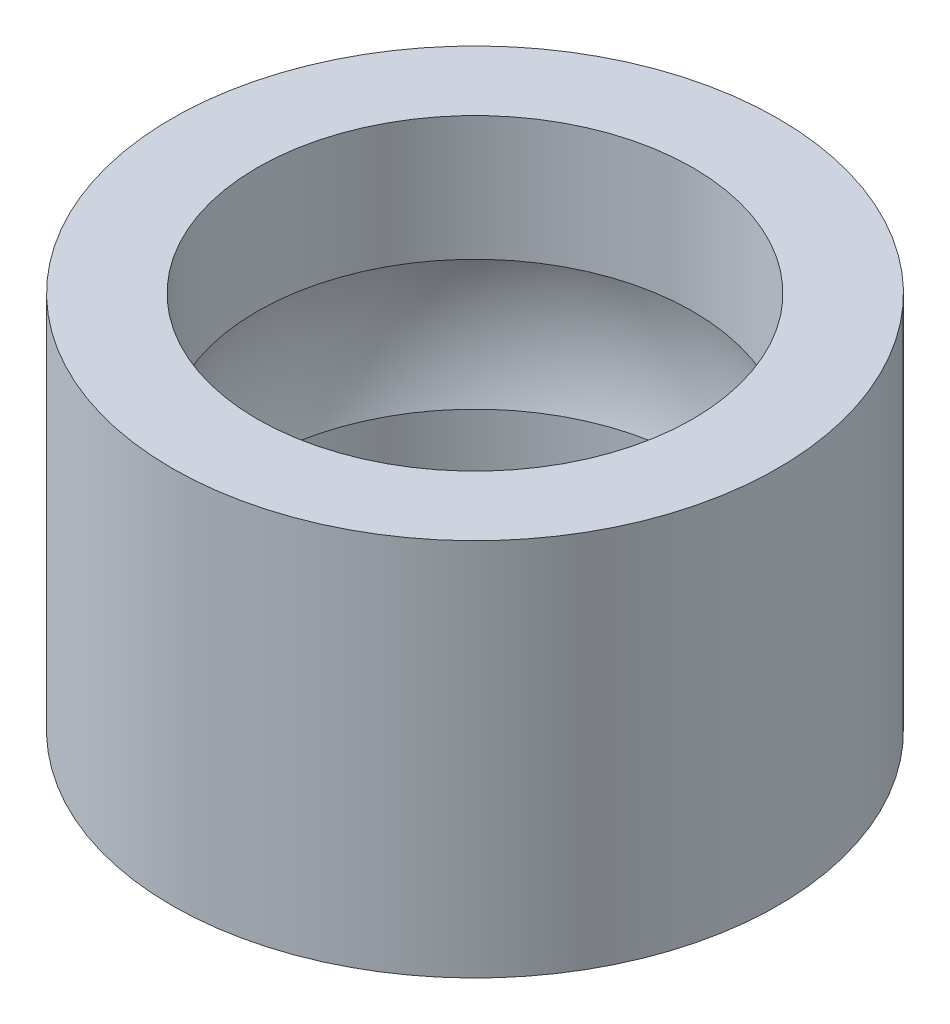
from build123d import *

# Parameters (mm, degrees)
SKETCH1_R           = 4
BOSS_EXTRUDE1_DEPTH = 5


with BuildPart() as part:
    # Sketch1 → Boss-Extrude1 (new body)
    with BuildSketch(Plane(origin=(0, 0, 0), x_dir=(1, 0, 0), z_dir=(0, 1, 0))):
        Circle(SKETCH1_R)
    extrude(amount=BOSS_EXTRUDE1_DEPTH)

    # Sketch3 → Cut-Revolve1 (revolve, cut)
    with BuildSketch(Plane(origin=(0, 0, 0), x_dir=(0, 0, -1), z_dir=(1, 0, 0))):
        with BuildLine():
            Line((0, 0), (0, 5))
            Line((0, 5), (-2.875, 5))
            Line((-2.875, 5), (-2.875, 3.356956825))
            ThreePointArc((-2.875, 3.356956825), (-3, 2.5), (-2.875, 1.643043175))
            Line((-2.875, 1.643043175), (-2.875, 0))
            Line((-2.875, 0), (0, 0))
        make_face()
    revolve(axis=Axis((0, 5.765782143, 0), (0, -1, 0)), mode=Mode.SUBTRACT)


solid = part.part
